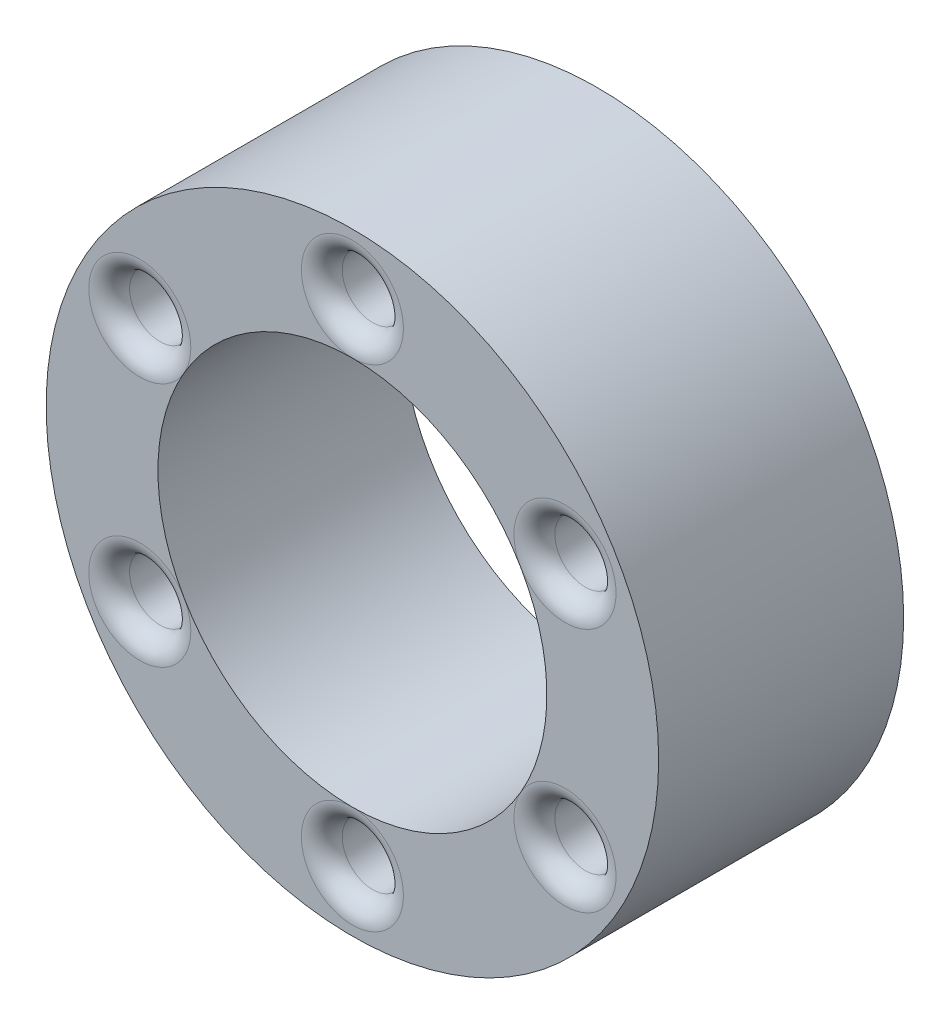
from build123d import *

# Parameters (mm, degrees)
SKETCH1_R           = 3.75
SKETCH1_R_2         = 2.38125
SKETCH1_R_3         = 0.375
BOSS_EXTRUDE1_DEPTH = 3
FILLET6_R           = 0.25


with BuildPart() as part:
    # Sketch1 → Boss-Extrude1 (new body)
    with BuildSketch(Plane.XY):
        Circle(SKETCH1_R)
        Circle(SKETCH1_R_2, mode=Mode.SUBTRACT)
        with Locations((0, 3.00625)):
            Circle(SKETCH1_R_3, mode=Mode.SUBTRACT)
        with Locations((2.60348887, 1.503125)):
            Circle(SKETCH1_R_3, mode=Mode.SUBTRACT)
        with Locations((2.60348887, -1.503125)):
            Circle(SKETCH1_R_3, mode=Mode.SUBTRACT)
        with Locations((0, -3.00625)):
            Circle(SKETCH1_R_3, mode=Mode.SUBTRACT)
        with Locations((-2.60348887, -1.503125)):
            Circle(SKETCH1_R_3, mode=Mode.SUBTRACT)
        with Locations((-2.60348887, 1.503125)):
            Circle(SKETCH1_R_3, mode=Mode.SUBTRACT)
    extrude(amount=BOSS_EXTRUDE1_DEPTH)

    # Fillet6
    fillet6_edges = [part.edges().sort_by_distance(p)[0] for p in [
        (-0.375, -3.00625, 0),
        (-0.375, -3.00625, 3),
        (2.22848887, 1.503125, 0),
        (2.22848887, 1.503125, 3),
        (2.22848887, -1.503125, 0),
        (2.22848887, -1.503125, 3),
        (-2.97848887, -1.503125, 0),
        (-2.97848887, -1.503125, 3),
        (-2.97848887, 1.503125, 0),
        (-2.97848887, 1.503125, 3),
        (-0.375, 3.00625, 0),
        (-0.375, 3.00625, 3),
    ]]
    fillet(fillet6_edges, radius=FILLET6_R - 0.0001)  # a hair under: the kernel refuses the full size


solid = part.part
